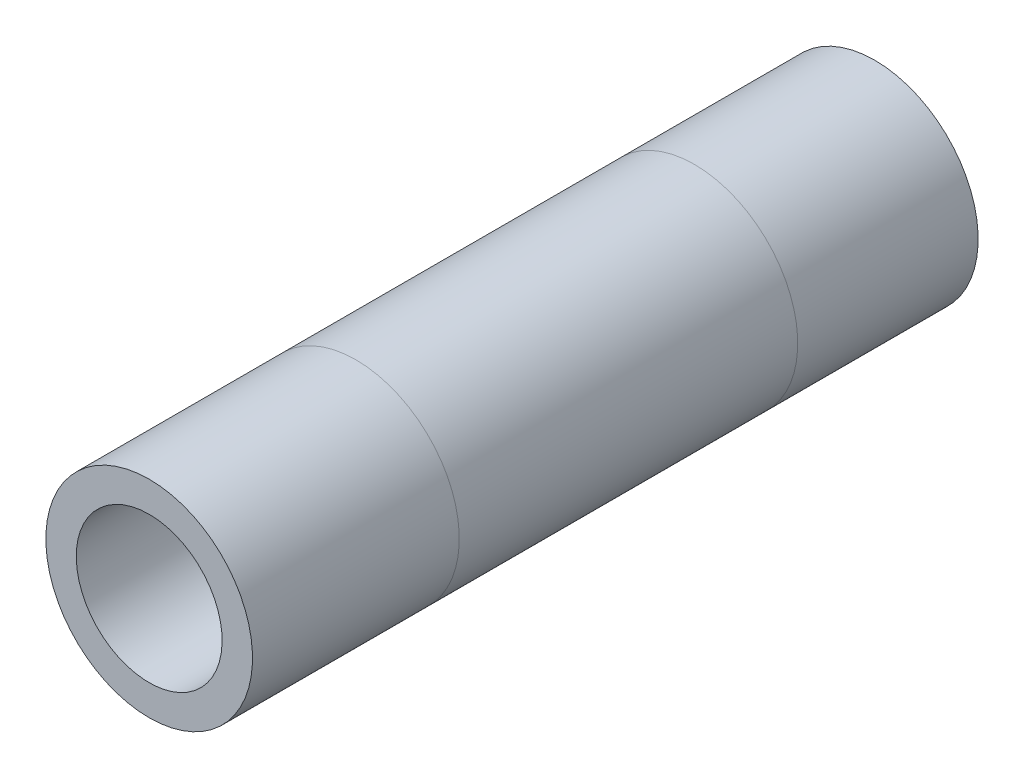
from build123d import *

# Parameters (mm, degrees)
SWEEP1_PROFILE_R     = 13.49375
CUT_SWEEP1_START     = -23.558
CUT_SWEEP1_OUTLINE_R = 9.525
CUT_SWEEP1_DEPTH     = 94.760068643


# Read off the part's stored shape, not the designer's step: Cut-Sweep1
with BuildPart() as part:
    # Sweep1: sweep along a curve in space
    with BuildLine() as sweep1_path:
        Line((0, 0, 0), (0, 0, -23.558))
        Line((0, 0, 0), (0, 0, 44.202068643))
        Line((0, 0, 44.202068643), (0, 0, 71.202068643))
    # Sweep1 profile (on start of the path) → Sweep1 (sweep)
    with BuildSketch(Plane(origin=(0, 0, 71.202068643), x_dir=(0, -1, 0), z_dir=(0, 0, -1))):
        Circle(SWEEP1_PROFILE_R)
    sweep(path=sweep1_path.line)

    # Cut-Sweep1 outline → Cut-Sweep1 (cut)
    with BuildSketch(Plane.XY.offset(CUT_SWEEP1_START)):
        Circle(CUT_SWEEP1_OUTLINE_R)
    extrude(amount=CUT_SWEEP1_DEPTH, mode=Mode.SUBTRACT)


solid = part.part
